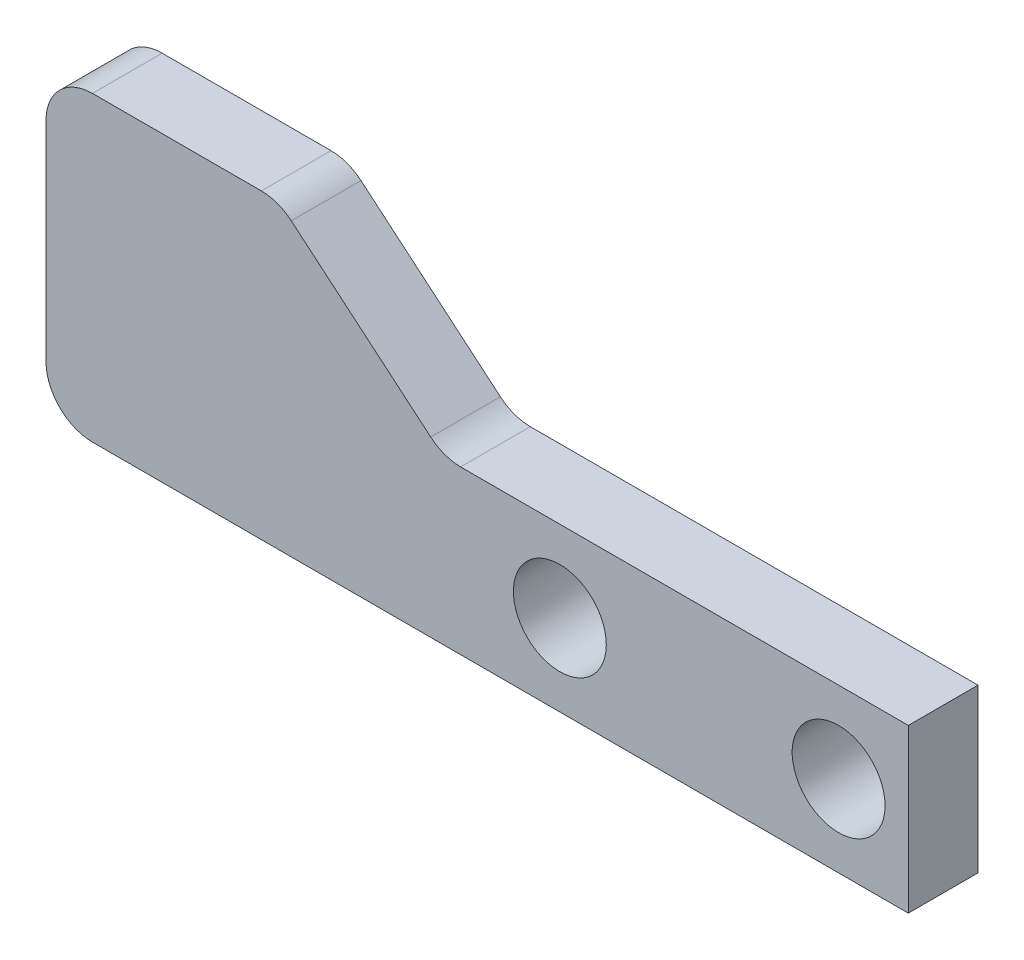
from build123d import *

# Parameters (mm, degrees)
SKETCH1_R           = 2
BOSS_EXTRUDE1_DEPTH = 1.5


with BuildPart() as part:
    # Sketch1 → Boss-Extrude1 (new, symmetric)
    with BuildSketch(Plane.XY):
        with BuildLine():
            Line((-9, -3.5), (9, -3.5))
            Line((9, -3.5), (9, 3.5))
            Line((9, 3.5), (-9, 3.5))
            Line((-9, 3.5), (-10.269445249, 3.5))
            ThreePointArc((-10.269445249, 3.5), (-10.95565342, 3.62140522), (-11.558552336, 3.970881654))
            Line((-11.558552336, 3.970881654), (-17.558552336, 9.029118346))
            ThreePointArc((-17.558552336, 9.029118346), (-18.161451253, 9.37859478), (-18.847659424, 9.5))
            Line((-18.847659424, 9.5), (-26.117104673, 9.5))
            ThreePointArc((-26.117104673, 9.5), (-27.531318235, 8.914213562), (-28.117104673, 7.5))
            Line((-28.117104673, 7.5), (-28.117104673, -1.5))
            ThreePointArc((-28.117104673, -1.5), (-27.531318235, -2.914213562), (-26.117104673, -3.5))
            Line((-26.117104673, -3.5), (-9, -3.5))
        make_face()
        with Locations((-6, 0)):
            Circle(SKETCH1_R, mode=Mode.SUBTRACT)
        with Locations((6, 0)):
            Circle(SKETCH1_R, mode=Mode.SUBTRACT)
    extrude(amount=BOSS_EXTRUDE1_DEPTH, both=True)


solid = part.part
